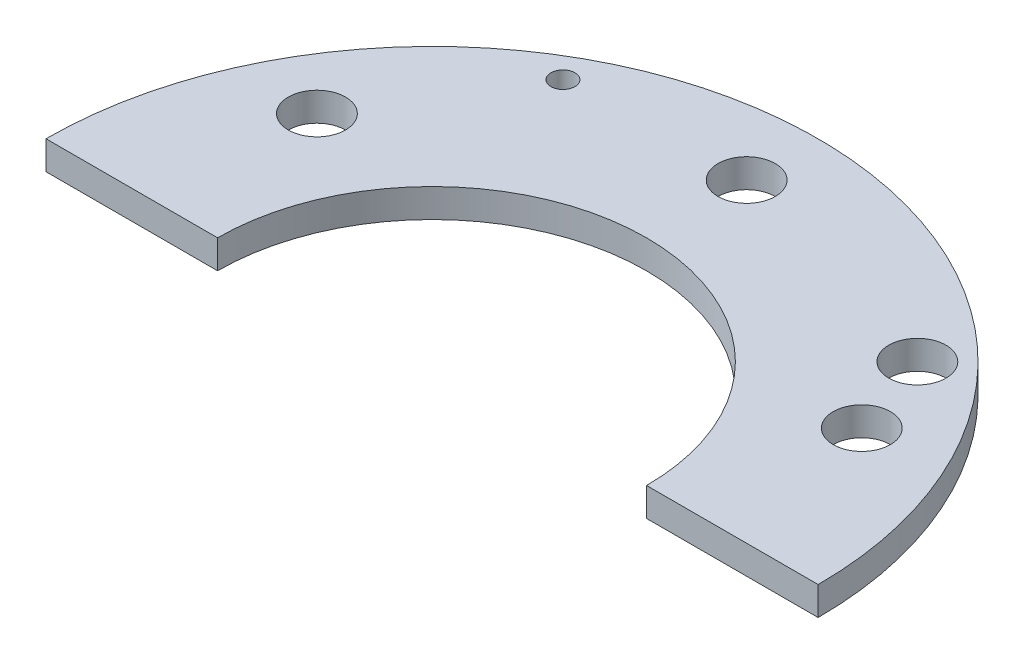
from build123d import *

# Parameters (mm, degrees)
SKETCH1_R               = 13.5
BOSS_EXTRUDE1_DEPTH     = 1
CUT_EXTRUDE1_DEPTH      = 20.118054294
CUT_EXTRUDE1_DEPTH_BACK = 20.118054294
SKETCH19_R              = 1
CUT_EXTRUDE2_DEPTH      = 20.118054294
CUT_EXTRUDE2_DEPTH_BACK = 20.118054294
SKETCH20_R              = 7.5
SKETCH21_W              = 65.874202484
SKETCH21_H              = 51.979273979
CUT_EXTRUDE3_DEPTH      = 20.118054294
CUT_EXTRUDE4_DEPTH      = 20.118054294
CUT_EXTRUDE4_DEPTH_BACK = 20.118054294
SKETCH22_R              = 0.42
CUT_EXTRUDE5_DEPTH      = 20.118054294
CUT_EXTRUDE5_DEPTH_BACK = 20.118054294
SKETCH23_R              = 1


with BuildPart() as part:
    # Sketch1 → Boss-Extrude1 (new body)
    with BuildSketch(Plane(origin=(0, 0, 0), x_dir=(1, 0, 0), z_dir=(0, 1, 0))):
        Circle(SKETCH1_R)
    extrude(amount=BOSS_EXTRUDE1_DEPTH)

    # Sketch19 → Cut-Extrude1 (cut, two sides: drawn at the far end of the back side and taken through both)
    with BuildSketch(Plane(origin=(0, 1, 0), x_dir=(1, 0, 0), z_dir=(0, 1, 0)).offset(-CUT_EXTRUDE1_DEPTH_BACK)):
        with Locations((0, 11)):
            Circle(SKETCH19_R)
        with Locations((9.526279442, 5.5)):
            Circle(SKETCH19_R)
        with Locations((9.526279442, -5.5)):
            Circle(SKETCH19_R)
        with Locations((0, -11)):
            Circle(SKETCH19_R)
        with Locations((-9.526279442, -5.5)):
            Circle(SKETCH19_R)
        with Locations((-9.526279442, 5.5)):
            Circle(SKETCH19_R)
    extrude(amount=CUT_EXTRUDE1_DEPTH + CUT_EXTRUDE1_DEPTH_BACK, mode=Mode.SUBTRACT)

    # Sketch20 → Cut-Extrude2 (cut, two sides: drawn at the far end of the back side and taken through both)
    with BuildSketch(Plane(origin=(0, 1, 0), x_dir=(1, 0, 0), z_dir=(0, 1, 0)).offset(-CUT_EXTRUDE2_DEPTH_BACK)):
        Circle(SKETCH20_R)
    extrude(amount=CUT_EXTRUDE2_DEPTH + CUT_EXTRUDE2_DEPTH_BACK, mode=Mode.SUBTRACT)

    # Sketch21 → Cut-Extrude3 (cut, through all)
    with BuildSketch(Plane.XY):
        with Locations((-3.816154381, 6.321647006)):
            Rectangle(SKETCH21_W, SKETCH21_H)
    extrude(amount=CUT_EXTRUDE3_DEPTH, mode=Mode.SUBTRACT)

    # Sketch22 → Cut-Extrude4 (cut, two sides: drawn at the far end of the back side and taken through both)
    with BuildSketch(Plane(origin=(0, 1, 0), x_dir=(1, 0, 0), z_dir=(0, 1, 0)).offset(-CUT_EXTRUDE4_DEPTH_BACK)):
        with Locations((-6.25, 10.825317547)):
            Circle(SKETCH22_R)
    extrude(amount=CUT_EXTRUDE4_DEPTH + CUT_EXTRUDE4_DEPTH_BACK, mode=Mode.SUBTRACT)

    # Sketch23 → Cut-Extrude5 (cut, two sides: drawn at the far end of the back side and taken through both)
    with BuildSketch(Plane(origin=(0, 1, 0), x_dir=(1, 0, 0), z_dir=(0, 1, 0)).offset(-CUT_EXTRUDE5_DEPTH_BACK)):
        with Locations((8.485281374, 8.485281374)):
            Circle(SKETCH23_R)
    extrude(amount=CUT_EXTRUDE5_DEPTH + CUT_EXTRUDE5_DEPTH_BACK, mode=Mode.SUBTRACT)


solid = part.part
